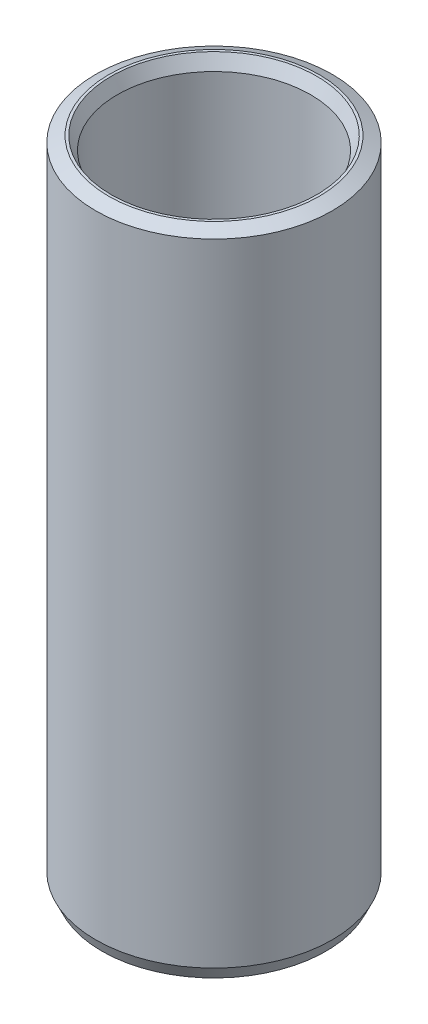
from build123d import *
from OCP.BRepFilletAPI import BRepFilletAPI_MakeChamfer

# Parameters (mm, degrees)
SKETCH1_R           = 37.5
BOSS_EXTRUDE1_DEPTH = 206.250763123
SKETCH2_R           = 30.629010666
CUT_EXTRUDE1_DEPTH  = 213.959802049
CHAMFER1_SIZE       = 1.94991739
CHAMFER1_SIZE2      = 4.09659132


with BuildPart() as part:
    # Sketch1 → Boss-Extrude1 (new body)
    with BuildSketch(Plane(origin=(0, 0, 0), x_dir=(1, 0, 0), z_dir=(0, 1, 0))):
        Circle(SKETCH1_R)
    extrude(amount=BOSS_EXTRUDE1_DEPTH)

    # Sketch2 → Cut-Extrude1 (cut, through all)
    with BuildSketch(Plane(origin=(0, 0, 0), x_dir=(1, 0, 0), z_dir=(0, 1, 0))):
        Circle(SKETCH2_R)
    extrude(amount=CUT_EXTRUDE1_DEPTH, mode=Mode.SUBTRACT)

    # Chamfer1: one chamfer whose edges measure the first distance from different faces: ONE call of the kernel's chamfer builder (chamfer() names one face for all edges)
    chamfer1_edges_1 = [part.edges().sort_by_distance(p)[0] for p in [
        (-30.629010666, 206.250763123, 0),
    ]]
    chamfer1_side_1 = [part.faces().sort_by_distance(p)[0] for p in [
        (-36.439339828, 206.250763123, 0),
    ]]
    chamfer1_edges_2 = [part.edges().sort_by_distance(p)[0] for p in [
        (-30.629010666, 0, 0),
    ]]
    chamfer1_side_2 = [part.faces().sort_by_distance(p)[0] for p in [
        (-30.629010666, 103.125381561, 0),
    ]]
    chamfer1_edges_3 = [part.edges().sort_by_distance(p)[0] for p in [
        (-37.5, 0, 0),
    ]]
    chamfer1_side_3 = [part.faces().sort_by_distance(p)[0] for p in [
        (-36.439339828, 0, 0),
    ]]
    chamfer1_edges_4 = [part.edges().sort_by_distance(p)[0] for p in [
        (-37.5, 206.250763123, 0),
    ]]
    chamfer1_side_4 = [part.faces().sort_by_distance(p)[0] for p in [
        (-37.5, 103.125381561, 0),
    ]]
    chamfer1 = BRepFilletAPI_MakeChamfer(part.part.solid().wrapped)
    for e in chamfer1_edges_1:
        chamfer1.Add(CHAMFER1_SIZE, CHAMFER1_SIZE2, e.wrapped, chamfer1_side_1[0].wrapped)  # the first distance lies on this face
    for e in chamfer1_edges_2:
        chamfer1.Add(CHAMFER1_SIZE, CHAMFER1_SIZE2, e.wrapped, chamfer1_side_2[0].wrapped)  # the first distance lies on this face
    for e in chamfer1_edges_3:
        chamfer1.Add(CHAMFER1_SIZE, CHAMFER1_SIZE2, e.wrapped, chamfer1_side_3[0].wrapped)  # the first distance lies on this face
    for e in chamfer1_edges_4:
        chamfer1.Add(CHAMFER1_SIZE, CHAMFER1_SIZE2, e.wrapped, chamfer1_side_4[0].wrapped)  # the first distance lies on this face
    add(Compound.cast(chamfer1.Shape()), mode=Mode.REPLACE)


solid = part.part
